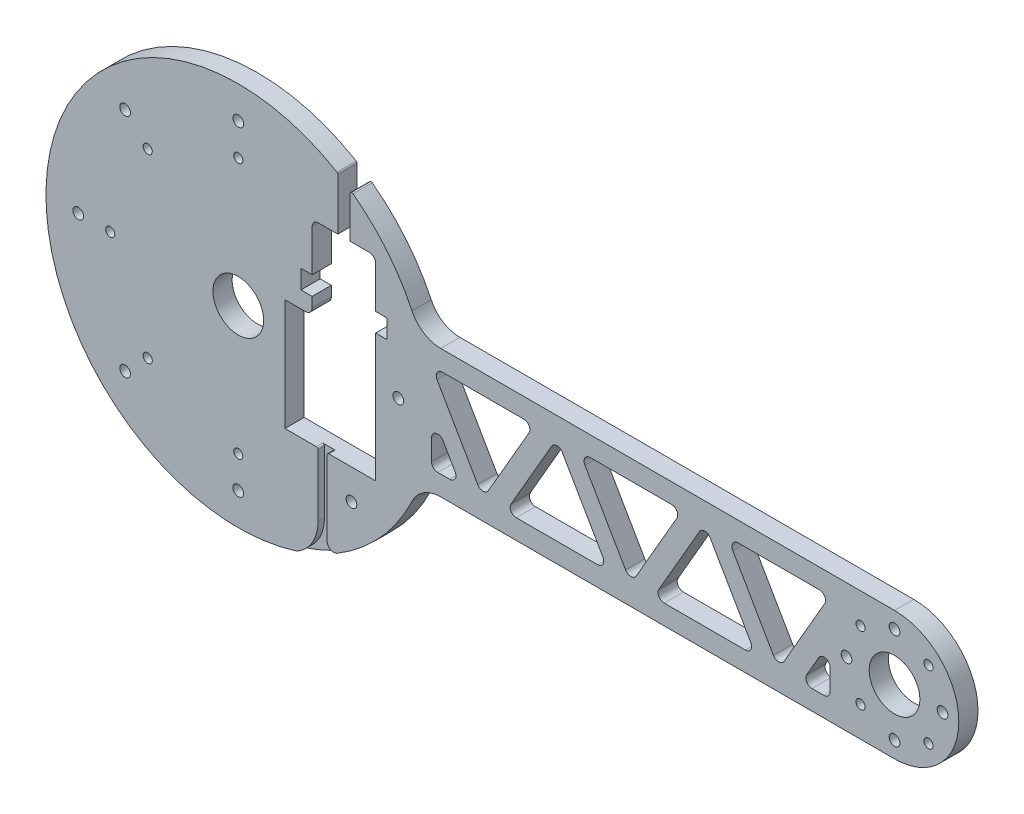
from build123d import *

# Parameters (mm, degrees)
SKETCH1_R              = 8
SKETCH1_R_2            = 1.75
SKETCH1_R_3            = 1.5
BOSS_EXTRUDE1_DEPTH    = 6
CUT_EXTRUDE2_DEPTH     = 233.939906414
CUT_EXTRUDE3_DEPTH     = 2
FILLET2_R              = 2
FILLET3_R              = 0.5
FILLET4_R              = 10
FILLET6_R              = 2
CUT_EXTRUDE5_DEPTH     = 233.939906414
FILLET7_R              = 2
SKETCH7_W              = 4
SKETCH7_H              = 50
CUT_EXTRUDE6_DEPTH     = 233.939906414
FILLET8_R              = 0.5
MOVE_FACE1_OUTLINE_R   = 8
MOVE_FACE1_OUTLINE_R_2 = 7.92
MOVE_FACE1_OUTLINE_R_3 = 1.75
MOVE_FACE1_OUTLINE_R_4 = 1.67
MOVE_FACE1_OUTLINE_R_5 = 1.5
MOVE_FACE1_OUTLINE_R_6 = 1.42
MOVE_FACE1_DEPTH       = 6
MOVE_FACE1_2_DEPTH     = 4


# Read off the part's stored shape, not the designer's step: Move Face1
with BuildPart() as part:
    # Sketch1 → Boss-Extrude1 (new body)
    with BuildSketch(Plane.XY):
        with BuildLine():
            Line((56.568542495, -20), (205, -20))
            ThreePointArc((205, -20), (225, 0), (205, 20))
            Line((205, 20), (56.568542495, 20))
            ThreePointArc((56.568542495, 20), (-60, 0), (56.568542495, -20))
        make_face()
        Circle(SKETCH1_R, mode=Mode.SUBTRACT)
        with Locations((205, 0)):
            Circle(SKETCH1_R, mode=Mode.SUBTRACT)
        with Locations((205, -15)):
            Circle(SKETCH1_R_2, mode=Mode.SUBTRACT)
        with Locations((215.606601718, -10.606601718)):
            Circle(SKETCH1_R_3, mode=Mode.SUBTRACT)
        with Locations((190, 0)):
            Circle(SKETCH1_R_2, mode=Mode.SUBTRACT)
        with Locations((194.393398282, -10.606601718)):
            Circle(SKETCH1_R_3, mode=Mode.SUBTRACT)
        with Locations((205, 15)):
            Circle(SKETCH1_R_2, mode=Mode.SUBTRACT)
        with Locations((194.393398282, 10.606601718)):
            Circle(SKETCH1_R_3, mode=Mode.SUBTRACT)
        with Locations((220, 0)):
            Circle(SKETCH1_R_2, mode=Mode.SUBTRACT)
        with Locations((215.606601718, 10.606601718)):
            Circle(SKETCH1_R_3, mode=Mode.SUBTRACT)
        with Locations((0, -40)):
            Circle(SKETCH1_R_3, mode=Mode.SUBTRACT)
        with Locations((0, -50)):
            Circle(SKETCH1_R_2, mode=Mode.SUBTRACT)
        with Locations((-28.284271247, -28.284271247)):
            Circle(SKETCH1_R_3, mode=Mode.SUBTRACT)
        with Locations((-35.355339059, -35.355339059)):
            Circle(SKETCH1_R_2, mode=Mode.SUBTRACT)
        with Locations((-40, 0)):
            Circle(SKETCH1_R_3, mode=Mode.SUBTRACT)
        with Locations((-50, 0)):
            Circle(SKETCH1_R_2, mode=Mode.SUBTRACT)
        with Locations((-28.284271247, 28.284271247)):
            Circle(SKETCH1_R_3, mode=Mode.SUBTRACT)
        with Locations((-35.355339059, 35.355339059)):
            Circle(SKETCH1_R_2, mode=Mode.SUBTRACT)
        with Locations((0, 40)):
            Circle(SKETCH1_R_3, mode=Mode.SUBTRACT)
        with Locations((0, 50)):
            Circle(SKETCH1_R_2, mode=Mode.SUBTRACT)
        with Locations((50, 0)):
            Circle(SKETCH1_R_2, mode=Mode.SUBTRACT)
        with Locations((35.355339059, -35.355339059)):
            Circle(SKETCH1_R_2, mode=Mode.SUBTRACT)
    extrude(amount=BOSS_EXTRUDE1_DEPTH)

    # Sketch3 → Cut-Extrude2 (cut, through all)
    with BuildSketch(Plane.XY.offset(6)):
        Polygon((14.5, -26), (43, -26), (43, 14), (46.5, 14), (46.5, 20), (43, 20), (43, 35), (23, 35), (23, 20), (19.5, 20), (19.5, 14), (23, 14), (23, 9), (14.5, 9), align=None)
    extrude(amount=-CUT_EXTRUDE2_DEPTH, mode=Mode.SUBTRACT)

    # Sketch4 → Cut-Extrude3 (cut)
    with BuildSketch(Plane.XY.offset(6)):
        with BuildLine():
            Line((24.828753827, -45.959), (24.828753827, -26))
            Line((24.828753827, -26), (27.828753827, -26))
            Line((27.828753827, -26), (27.828753827, -58.787753827))
            Line((27.828753827, -58.787753827), (12, -58.787753827))
            ThreePointArc((12, -58.787753827), (21.071298825, -55.030298825), (24.828753827, -45.959))
        make_face()
    extrude(amount=-CUT_EXTRUDE3_DEPTH, mode=Mode.SUBTRACT)

    # Fillet2
    fillet2_edges = [part.edges().sort_by_distance(p)[0] for p in [
        (27.828753827, -53.156001171, 5),
    ]]
    fillet(fillet2_edges, radius=FILLET2_R)

    # Fillet3
    fillet3_edges = [part.edges().sort_by_distance(p)[0] for p in [
        (27.828753827, -26, 5),
        (24.828753827, -26, 5),
    ]]
    fillet(fillet3_edges, radius=FILLET3_R)

    # Fillet4
    fillet4_edges = [part.edges().sort_by_distance(p)[0] for p in [
        (56.568542495, 20, 3),
        (56.568542495, -20, 3),
    ]]
    fillet(fillet4_edges, radius=FILLET4_R)

    # Fillet6
    fillet6_edges = [part.edges().sort_by_distance(p)[0] for p in [
        (23, 9, 3),
        (23, 35, 3),
        (43, 35, 3),
    ]]
    fillet(fillet6_edges, radius=FILLET6_R)

    # Sketch6 → Cut-Extrude5 (cut, through all)
    with BuildSketch(Plane.XY.offset(6)):
        Polygon((60.292341855, 14), (92.62395693, 14), (76.458149392, -14), align=None)
        Polygon((83.386352623, -14), (99.55216016, 14), (115.717967697, -14), align=None)
        Polygon((106.48036339, 14), (122.646170928, -14), (138.811978465, 14), align=None)
        Polygon((129.574374158, -14), (145.740181695, 14), (161.905989232, -14), align=None)
        Polygon((152.668384925, 14), (168.834192463, -14), (185, 14), align=None)
        Polygon((60.292341855, 2), (60.292341855, -14), (69.529946162, -14), align=None)
        Polygon((185, 2), (185, -14), (175.762395693, -14), align=None)
    extrude(amount=-CUT_EXTRUDE5_DEPTH, mode=Mode.SUBTRACT)

    # Fillet7
    fillet7_edges = [part.edges().sort_by_distance(p)[0] for p in [
        (76.458149392, -14, 3),
        (60.292341855, 14, 3),
        (92.62395693, 14, 3),
        (115.717967697, -14, 3),
        (83.386352623, -14, 3),
        (99.55216016, 14, 3),
        (106.48036339, 14, 3),
        (138.811978465, 14, 3),
        (122.646170928, -14, 3),
        (161.905989232, -14, 3),
        (129.574374158, -14, 3),
        (145.740181695, 14, 3),
        (152.668384925, 14, 3),
        (185, 14, 3),
        (168.834192463, -14, 3),
        (60.292341855, 2, 3),
        (69.529946162, -14, 3),
        (60.292341855, -14, 3),
        (175.762395693, -14, 3),
        (185, 2, 3),
        (185, -14, 3),
    ]]
    fillet(fillet7_edges, radius=FILLET7_R)

    # Sketch7 → Cut-Extrude6 (cut, through all)
    with BuildSketch(Plane.XY.offset(6)):
        with Locations((33, 35)):
            Rectangle(SKETCH7_W, SKETCH7_H)
    extrude(amount=-CUT_EXTRUDE6_DEPTH, mode=Mode.SUBTRACT)

    # Fillet8
    fillet8_edges = [part.edges().sort_by_distance(p)[0] for p in [
        (35, 48.733971724, 3),
        (31, 51.371198156, 3),
    ]]
    fillet(fillet8_edges, radius=FILLET8_R)

    # Move Face1 outline → Move Face1 (add)
    # profile 1 of 31: a face of its own
    with BuildSketch(Plane.XY):
        with BuildLine():
            ThreePointArc((54.282754807, 25.748571429), (46.443333802, 38.113293552), (35.84605042, 48.214801351))
            ThreePointArc((35.84605042, 48.214801351), (35.239528546, 48.267568105), (34.92, 47.749345545))
            Line((34.92, 47.749345545), (34.92, 34.92))
            Line((34.92, 34.92), (41, 34.92))
            ThreePointArc((41, 34.92), (42.35764502, 34.35764502), (42.92, 33))
            Line((42.92, 33), (42.92, 19.92))
            Line((42.92, 19.92), (46.42, 19.92))
            Line((46.42, 19.92), (46.42, 14.08))
            Line((46.42, 14.08), (42.92, 14.08))
            Line((42.92, 14.08), (42.92, -25.92))
            Line((42.92, -25.92), (28.328753827, -25.92))
            ThreePointArc((28.328753827, -25.92), (27.918631894, -26.089878067), (27.748753827, -26.5))
            Line((27.748753827, -26.5), (27.748753827, -49.741787716))
            ThreePointArc((27.748753827, -49.741787716), (28.803721954, -51.551679884), (30.898474654, -51.525631137))
            ThreePointArc((30.898474654, -51.525631137), (44.4980299, -40.367458864), (54.282754807, -25.748571429))
            ThreePointArc((54.282754807, -25.748571429), (57.943090164, -21.616069793), (63.245553203, -20.08))
            Line((63.245553203, -20.08), (205, -20.08))
            ThreePointArc((205, -20.08), (225.08, 0), (205, 20.08))
            Line((205, 20.08), (63.245553203, 20.08))
            ThreePointArc((63.245553203, 20.08), (57.943090164, 21.616069793), (54.282754807, 25.748571429))
        make_face()
        with BuildLine():
            ThreePointArc((54.210474174, -25.714285714), (44.438778194, -40.313707254), (30.857331545, -51.457021774))
            ThreePointArc((30.857331545, -51.457021774), (28.843146257, -51.482068646), (27.828753827, -49.741787716))
            Line((27.828753827, -49.741787716), (27.828753827, -26.5))
            ThreePointArc((27.828753827, -26.5), (27.975200436, -26.146446609), (28.328753827, -26))
            Line((28.328753827, -26), (43, -26))
            Line((43, -26), (43, 14))
            Line((43, 14), (46.5, 14))
            Line((46.5, 14), (46.5, 20))
            Line((46.5, 20), (43, 20))
            Line((43, 20), (43, 33))
            ThreePointArc((43, 33), (42.414213562, 34.414213562), (41, 35))
            Line((41, 35), (35, 35))
            Line((35, 35), (35, 47.749345545))
            ThreePointArc((35, 47.749345545), (35.275455643, 48.196089132), (35.798319328, 48.15060055))
            ThreePointArc((35.798319328, 48.15060055), (46.381491813, 38.062543494), (54.210474174, 25.714285714))
            ThreePointArc((54.210474174, 25.714285714), (57.900328365, 21.548457453), (63.245553203, 20))
            Line((63.245553203, 20), (205, 20))
            ThreePointArc((205, 20), (225, 0), (205, -20))
            Line((205, -20), (63.245553203, -20))
            ThreePointArc((63.245553203, -20), (57.900328365, -21.548457453), (54.210474174, -25.714285714))
        make_face(mode=Mode.SUBTRACT)
    # profile 2 of 31: a face of its own
    with BuildSketch(Plane.XY):
        with BuildLine():
            ThreePointArc((30.797310924, 51.586161321), (-59.687835994, 6.853366641), (18.303717078, -57.223949018))
            ThreePointArc((18.303717078, -57.223949018), (23.135732067, -52.488272295), (24.908753827, -45.959))
            Line((24.908753827, -45.959), (24.908753827, -26.5))
            ThreePointArc((24.908753827, -26.5), (24.73887576, -26.089878067), (24.328753827, -25.92))
            Line((24.328753827, -25.92), (14.58, -25.92))
            Line((14.58, -25.92), (14.58, 8.92))
            Line((14.58, 8.92), (21, 8.92))
            ThreePointArc((21, 8.92), (22.470782105, 9.529217895), (23.08, 11))
            Line((23.08, 11), (23.08, 14.08))
            Line((23.08, 14.08), (19.58, 14.08))
            Line((19.58, 14.08), (19.58, 19.92))
            Line((19.58, 19.92), (23.08, 19.92))
            Line((23.08, 19.92), (23.08, 33))
            ThreePointArc((23.08, 33), (23.64235498, 34.35764502), (25, 34.92))
            Line((25, 34.92), (31.08, 34.92))
            Line((31.08, 34.92), (31.08, 51.088159098))
            ThreePointArc((31.08, 51.088159098), (31.004400801, 51.374480302), (30.797310924, 51.586161321))
        make_face()
        with BuildLine():
            Line((14.5, -26), (24.328753827, -26))
            ThreePointArc((24.328753827, -26), (24.682307218, -26.146446609), (24.828753827, -26.5))
            Line((24.828753827, -26.5), (24.828753827, -45.959))
            ThreePointArc((24.828753827, -45.959), (23.06875318, -52.444339451), (18.271666777, -57.150207289))
            ThreePointArc((18.271666777, -57.150207289), (-59.607898294, 6.848245099), (30.756302521, 51.517471359))
            ThreePointArc((30.756302521, 51.517471359), (30.934828277, 51.334987722), (31, 51.088159098))
            Line((31, 51.088159098), (31, 35))
            Line((31, 35), (25, 35))
            ThreePointArc((25, 35), (23.585786438, 34.414213562), (23, 33))
            Line((23, 33), (23, 20))
            Line((23, 20), (19.5, 20))
            Line((19.5, 20), (19.5, 14))
            Line((19.5, 14), (23, 14))
            Line((23, 14), (23, 11))
            ThreePointArc((23, 11), (22.414213562, 9.585786438), (21, 9))
            Line((21, 9), (14.5, 9))
            Line((14.5, 9), (14.5, -26))
        make_face(mode=Mode.SUBTRACT)
    # profile 3 of 31: a face of its own
    with BuildSketch(Plane.XY):
        Circle(MOVE_FACE1_OUTLINE_R)
        Circle(MOVE_FACE1_OUTLINE_R_2, mode=Mode.SUBTRACT)
    # profile 4 of 31: a face of its own
    with BuildSketch(Plane.XY):
        with Locations((205, 0)):
            Circle(MOVE_FACE1_OUTLINE_R)
        with Locations((205, 0)):
            Circle(MOVE_FACE1_OUTLINE_R_2, mode=Mode.SUBTRACT)
    # profile 5 of 31: a face of its own
    with BuildSketch(Plane.XY):
        with Locations((205, -15)):
            Circle(MOVE_FACE1_OUTLINE_R_3)
        with Locations((205, -15)):
            Circle(MOVE_FACE1_OUTLINE_R_4, mode=Mode.SUBTRACT)
    # profile 6 of 31: a face of its own
    with BuildSketch(Plane.XY):
        with Locations((215.606601718, -10.606601718)):
            Circle(MOVE_FACE1_OUTLINE_R_5)
        with Locations((215.606601718, -10.606601718)):
            Circle(MOVE_FACE1_OUTLINE_R_6, mode=Mode.SUBTRACT)
    # profile 7 of 31: a face of its own
    with BuildSketch(Plane.XY):
        with Locations((190, 0)):
            Circle(MOVE_FACE1_OUTLINE_R_3)
        with Locations((190, 0)):
            Circle(MOVE_FACE1_OUTLINE_R_4, mode=Mode.SUBTRACT)
    # profile 8 of 31: a face of its own
    with BuildSketch(Plane.XY):
        with Locations((194.393398282, -10.606601718)):
            Circle(MOVE_FACE1_OUTLINE_R_5)
        with Locations((194.393398282, -10.606601718)):
            Circle(MOVE_FACE1_OUTLINE_R_6, mode=Mode.SUBTRACT)
    # profile 9 of 31: a face of its own
    with BuildSketch(Plane.XY):
        with Locations((205, 15)):
            Circle(MOVE_FACE1_OUTLINE_R_3)
        with Locations((205, 15)):
            Circle(MOVE_FACE1_OUTLINE_R_4, mode=Mode.SUBTRACT)
    # profile 10 of 31: a face of its own
    with BuildSketch(Plane.XY):
        with Locations((194.393398282, 10.606601718)):
            Circle(MOVE_FACE1_OUTLINE_R_5)
        with Locations((194.393398282, 10.606601718)):
            Circle(MOVE_FACE1_OUTLINE_R_6, mode=Mode.SUBTRACT)
    # profile 11 of 31: a face of its own
    with BuildSketch(Plane.XY):
        with Locations((220, 0)):
            Circle(MOVE_FACE1_OUTLINE_R_3)
        with Locations((220, 0)):
            Circle(MOVE_FACE1_OUTLINE_R_4, mode=Mode.SUBTRACT)
    # profile 12 of 31: a face of its own
    with BuildSketch(Plane.XY):
        with Locations((215.606601718, 10.606601718)):
            Circle(MOVE_FACE1_OUTLINE_R_5)
        with Locations((215.606601718, 10.606601718)):
            Circle(MOVE_FACE1_OUTLINE_R_6, mode=Mode.SUBTRACT)
    # profile 13 of 31: a face of its own
    with BuildSketch(Plane.XY):
        with Locations((0, -40)):
            Circle(MOVE_FACE1_OUTLINE_R_5)
        with Locations((0, -40)):
            Circle(MOVE_FACE1_OUTLINE_R_6, mode=Mode.SUBTRACT)
    # profile 14 of 31: a face of its own
    with BuildSketch(Plane.XY):
        with Locations((0, -50)):
            Circle(MOVE_FACE1_OUTLINE_R_3)
        with Locations((0, -50)):
            Circle(MOVE_FACE1_OUTLINE_R_4, mode=Mode.SUBTRACT)
    # profile 15 of 31: a face of its own
    with BuildSketch(Plane.XY):
        with Locations((-28.284271247, -28.284271247)):
            Circle(MOVE_FACE1_OUTLINE_R_5)
        with Locations((-28.284271247, -28.284271247)):
            Circle(MOVE_FACE1_OUTLINE_R_6, mode=Mode.SUBTRACT)
    # profile 16 of 31: a face of its own
    with BuildSketch(Plane.XY):
        with Locations((-35.355339059, -35.355339059)):
            Circle(MOVE_FACE1_OUTLINE_R_3)
        with Locations((-35.355339059, -35.355339059)):
            Circle(MOVE_FACE1_OUTLINE_R_4, mode=Mode.SUBTRACT)
    # profile 17 of 31: a face of its own
    with BuildSketch(Plane.XY):
        with Locations((-40, 0)):
            Circle(MOVE_FACE1_OUTLINE_R_5)
        with Locations((-40, 0)):
            Circle(MOVE_FACE1_OUTLINE_R_6, mode=Mode.SUBTRACT)
    # profile 18 of 31: a face of its own
    with BuildSketch(Plane.XY):
        with Locations((-50, 0)):
            Circle(MOVE_FACE1_OUTLINE_R_3)
        with Locations((-50, 0)):
            Circle(MOVE_FACE1_OUTLINE_R_4, mode=Mode.SUBTRACT)
    # profile 19 of 31: a face of its own
    with BuildSketch(Plane.XY):
        with Locations((-28.284271247, 28.284271247)):
            Circle(MOVE_FACE1_OUTLINE_R_5)
        with Locations((-28.284271247, 28.284271247)):
            Circle(MOVE_FACE1_OUTLINE_R_6, mode=Mode.SUBTRACT)
    # profile 20 of 31: a face of its own
    with BuildSketch(Plane.XY):
        with Locations((-35.355339059, 35.355339059)):
            Circle(MOVE_FACE1_OUTLINE_R_3)
        with Locations((-35.355339059, 35.355339059)):
            Circle(MOVE_FACE1_OUTLINE_R_4, mode=Mode.SUBTRACT)
    # profile 21 of 31: a face of its own
    with BuildSketch(Plane.XY):
        with Locations((0, 40)):
            Circle(MOVE_FACE1_OUTLINE_R_5)
        with Locations((0, 40)):
            Circle(MOVE_FACE1_OUTLINE_R_6, mode=Mode.SUBTRACT)
    # profile 22 of 31: a face of its own
    with BuildSketch(Plane.XY):
        with Locations((0, 50)):
            Circle(MOVE_FACE1_OUTLINE_R_3)
        with Locations((0, 50)):
            Circle(MOVE_FACE1_OUTLINE_R_4, mode=Mode.SUBTRACT)
    # profile 23 of 31: a face of its own
    with BuildSketch(Plane.XY):
        with Locations((50, 0)):
            Circle(MOVE_FACE1_OUTLINE_R_3)
        with Locations((50, 0)):
            Circle(MOVE_FACE1_OUTLINE_R_4, mode=Mode.SUBTRACT)
    # profile 24 of 31: a face of its own
    with BuildSketch(Plane.XY):
        with Locations((35.355339059, -35.355339059)):
            Circle(MOVE_FACE1_OUTLINE_R_3)
        with Locations((35.355339059, -35.355339059)):
            Circle(MOVE_FACE1_OUTLINE_R_4, mode=Mode.SUBTRACT)
    # profile 25 of 31: a face of its own
    with BuildSketch(Plane.XY):
        with BuildLine():
            ThreePointArc((63.75644347, 14), (62.024392663, 13), (62.024392663, 11))
            Line((62.024392663, 11), (74.726098585, -11))
            ThreePointArc((74.726098585, -11), (76.458149392, -12), (78.1902002, -11))
            Line((78.1902002, -11), (90.891906122, 11))
            ThreePointArc((90.891906122, 11), (90.891906122, 13), (89.159855315, 14))
            Line((89.159855315, 14), (63.75644347, 14))
        make_face()
        with BuildLine():
            Line((74.795380617, -10.96), (62.093674695, 11.04))
            ThreePointArc((62.093674695, 11.04), (62.093674695, 12.96), (63.75644347, 13.92))
            Line((63.75644347, 13.92), (89.159855315, 13.92))
            ThreePointArc((89.159855315, 13.92), (90.82262409, 12.96), (90.82262409, 11.04))
            Line((90.82262409, 11.04), (78.120918168, -10.96))
            ThreePointArc((78.120918168, -10.96), (76.458149393, -11.92), (74.795380617, -10.96))
        make_face(mode=Mode.SUBTRACT)
    # profile 26 of 31: a face of its own
    with BuildSketch(Plane.XY):
        with BuildLine():
            ThreePointArc((137.079927657, 11), (137.079927657, 13), (135.34787685, 14))
            Line((135.34787685, 14), (109.944465005, 14))
            ThreePointArc((109.944465005, 14), (108.212414198, 13), (108.212414198, 11))
            Line((108.212414198, 11), (120.91412012, -11))
            ThreePointArc((120.91412012, -11), (122.646170928, -12), (124.378221735, -11))
            Line((124.378221735, -11), (137.079927657, 11))
        make_face()
        with BuildLine():
            Line((109.944465005, 13.92), (135.34787685, 13.92))
            ThreePointArc((135.34787685, 13.92), (137.010645625, 12.96), (137.010645625, 11.04))
            Line((137.010645625, 11.04), (124.308939703, -10.96))
            ThreePointArc((124.308939703, -10.96), (122.646170927, -11.92), (120.983402152, -10.96))
            Line((120.983402152, -10.96), (108.28169623, 11.04))
            ThreePointArc((108.28169623, 11.04), (108.28169623, 12.96), (109.944465005, 13.92))
        make_face(mode=Mode.SUBTRACT)
    # profile 27 of 31: a face of its own
    with BuildSketch(Plane.XY):
        with BuildLine():
            ThreePointArc((183.267949192, 11), (183.267949192, 13), (181.535898385, 14))
            Line((181.535898385, 14), (156.132486541, 14))
            ThreePointArc((156.132486541, 14), (154.400435733, 13), (154.400435733, 11))
            Line((154.400435733, 11), (167.102141655, -11))
            ThreePointArc((167.102141655, -11), (168.834192462, -12), (170.56624327, -11))
            Line((170.56624327, -11), (183.267949192, 11))
        make_face()
        with BuildLine():
            Line((156.132486541, 13.92), (181.535898385, 13.92))
            ThreePointArc((181.535898385, 13.92), (183.19866716, 12.96), (183.19866716, 11.04))
            Line((183.19866716, 11.04), (170.496961238, -10.96))
            ThreePointArc((170.496961238, -10.96), (168.834192462, -11.92), (167.171423687, -10.96))
            Line((167.171423687, -10.96), (154.469717765, 11.04))
            ThreePointArc((154.469717765, 11.04), (154.469717765, 12.96), (156.132486541, 13.92))
        make_face(mode=Mode.SUBTRACT)
    # profile 28 of 31: a face of its own
    with BuildSketch(Plane.XY):
        with BuildLine():
            ThreePointArc((85.11840343, -11), (85.11840343, -13), (86.850454238, -14))
            Line((86.850454238, -14), (112.253866082, -14))
            ThreePointArc((112.253866082, -14), (113.98591689, -13), (113.98591689, -11))
            Line((113.98591689, -11), (101.284210968, 11))
            ThreePointArc((101.284210968, 11), (99.55216016, 12), (97.820109352, 11))
            Line((97.820109352, 11), (85.11840343, -11))
        make_face()
        with BuildLine():
            Line((112.253866082, -13.92), (86.850454238, -13.92))
            ThreePointArc((86.850454238, -13.92), (85.187685462, -12.96), (85.187685462, -11.04))
            Line((85.187685462, -11.04), (97.889391385, 10.96))
            ThreePointArc((97.889391385, 10.96), (99.55216016, 11.92), (101.214928935, 10.96))
            Line((101.214928935, 10.96), (113.916634857, -11.04))
            ThreePointArc((113.916634857, -11.04), (113.916634857, -12.96), (112.253866082, -13.92))
        make_face(mode=Mode.SUBTRACT)
    # profile 29 of 31: a face of its own
    with BuildSketch(Plane.XY):
        with BuildLine():
            ThreePointArc((131.306424965, -11), (131.306424965, -13), (133.038475773, -14))
            Line((133.038475773, -14), (158.441887617, -14))
            ThreePointArc((158.441887617, -14), (160.173938425, -13), (160.173938425, -11))
            Line((160.173938425, -11), (147.472232503, 11))
            ThreePointArc((147.472232503, 11), (145.740181696, 12), (144.008130888, 11))
            Line((144.008130888, 11), (131.306424965, -11))
        make_face()
        with BuildLine():
            Line((158.441887617, -13.92), (133.038475773, -13.92))
            ThreePointArc((133.038475773, -13.92), (131.375706998, -12.96), (131.375706998, -11.04))
            Line((131.375706998, -11.04), (144.07741292, 10.96))
            ThreePointArc((144.07741292, 10.96), (145.740181695, 11.92), (147.40295047, 10.96))
            Line((147.40295047, 10.96), (160.104656393, -11.04))
            ThreePointArc((160.104656393, -11.04), (160.104656393, -12.96), (158.441887617, -13.92))
        make_face(mode=Mode.SUBTRACT)
    # profile 30 of 31: a face of its own
    with BuildSketch(Plane.XY):
        with BuildLine():
            ThreePointArc((60.292341855, -12), (60.878128293, -13.414213562), (62.292341855, -14))
            Line((62.292341855, -14), (66.065844547, -14))
            ThreePointArc((66.065844547, -14), (67.797895355, -13), (67.797895355, -11))
            Line((67.797895355, -11), (64.024392663, -4.464101615))
            ThreePointArc((64.024392663, -4.464101615), (61.774703765, -3.532249963), (60.292341855, -5.464101615))
            Line((60.292341855, -5.464101615), (60.292341855, -12))
        make_face()
        with BuildLine():
            Line((66.065844547, -13.92), (62.292341855, -13.92))
            ThreePointArc((62.292341855, -13.92), (60.934696835, -13.35764502), (60.372341855, -12))
            Line((60.372341855, -12), (60.372341855, -5.464101615))
            ThreePointArc((60.372341855, -5.464101615), (61.795409288, -3.609524029), (63.95511063, -4.504101615))
            Line((63.95511063, -4.504101615), (67.728613322, -11.04))
            ThreePointArc((67.728613322, -11.04), (67.728613322, -12.96), (66.065844547, -13.92))
        make_face(mode=Mode.SUBTRACT)
    # profile 31 of 31: a face of its own
    with BuildSketch(Plane.XY):
        with BuildLine():
            ThreePointArc((177.494446501, -11), (177.494446501, -13), (179.226497308, -14))
            Line((179.226497308, -14), (183, -14))
            ThreePointArc((183, -14), (184.414213562, -13.414213562), (185, -12))
            Line((185, -12), (185, -5.464101615))
            ThreePointArc((185, -5.464101615), (183.51763809, -3.532249963), (181.267949192, -4.464101615))
            Line((181.267949192, -4.464101615), (177.494446501, -11))
        make_face()
        with BuildLine():
            Line((183, -13.92), (179.226497308, -13.92))
            ThreePointArc((179.226497308, -13.92), (177.563728533, -12.96), (177.563728533, -11.04))
            Line((177.563728533, -11.04), (181.337231225, -4.504101615))
            ThreePointArc((181.337231225, -4.504101615), (183.496932567, -3.609524029), (184.92, -5.464101615))
            Line((184.92, -5.464101615), (184.92, -12))
            ThreePointArc((184.92, -12), (184.35764502, -13.35764502), (183, -13.92))
        make_face(mode=Mode.SUBTRACT)
    extrude(amount=MOVE_FACE1_DEPTH)

    # Move Face1 2 outline → Move Face1 2 (add)
    with BuildSketch(Plane.XY):
        with BuildLine():
            ThreePointArc((18.303717078, -57.223949018), (24.765532994, -54.738238697), (30.898474654, -51.525631138))
            ThreePointArc((30.898474654, -51.525631138), (30.636086216, -51.658716096), (30.357545289, -51.753448619))
            ThreePointArc((30.357545289, -51.753448619), (24.636838099, -54.708556994), (18.632402432, -57.033617977))
            ThreePointArc((18.632402432, -57.033617977), (18.468759809, -57.129992431), (18.303717078, -57.223949018))
        make_face()
        with BuildLine():
            ThreePointArc((28.034815058, -26), (28.176438365, -25.940357257), (28.328753827, -25.92))
            Line((28.328753827, -25.92), (24.328753827, -25.92))
            ThreePointArc((24.328753827, -25.92), (24.481069289, -25.940357257), (24.622692596, -26))
            Line((24.622692596, -26), (28.034815058, -26))
        make_face()
    extrude(amount=MOVE_FACE1_2_DEPTH)


solid = part.part
